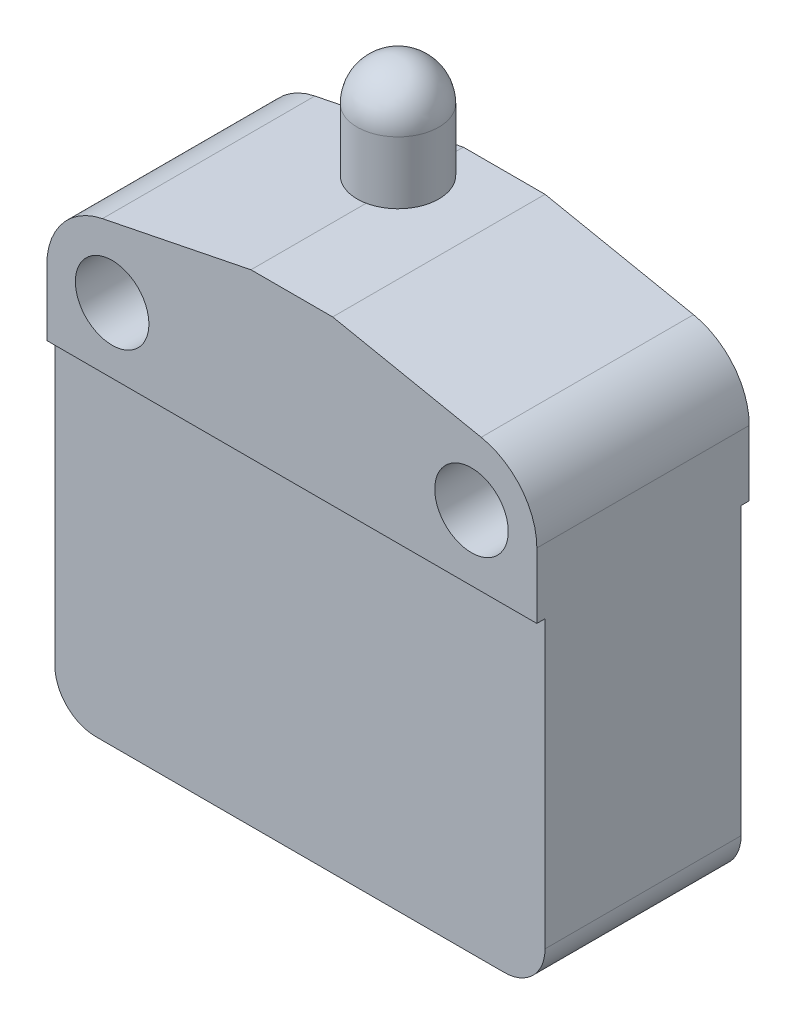
from build123d import *

# Parameters (mm, degrees)
SKETCH1_R              = 2.25
BOSS_EXTRUDE1_DEPTH    = 6.5
SKETCH2_R              = 2.5
BOSS_EXTRUDE2_DEPTH    = 9.3
FILLET1_R              = 2.49
CUT_EXTRUDE1_START     = -20
CUT_EXTRUDE1_OUTLINE_W = 30
CUT_EXTRUDE1_OUTLINE_H = 0.5
CUT_EXTRUDE1_DEPTH     = 20
CUT_EXTRUDE4_START     = -3
SKETCH6_R              = 2.5
CUT_EXTRUDE4_DEPTH     = 3


# Read off the part's stored shape, not the designer's step: Cut-Extrude1
with BuildPart() as part:
    # Sketch1 → Boss-Extrude1 (new, symmetric)
    with BuildSketch(Plane.XY):
        with BuildLine():
            Line((-2.5, 15), (-11.59047228, 13.166066052))
            ThreePointArc((-11.59047228, 13.166066052), (-14.038959348, 11.691699538), (-15, 9))
            Line((-15, 9), (-15, -12.5))
            ThreePointArc((-15, -12.5), (-14.267766953, -14.267766953), (-12.5, -15))
            Line((-12.5, -15), (12.5, -15))
            ThreePointArc((12.5, -15), (14.267766953, -14.267766953), (15, -12.5))
            Line((15, -12.5), (15, 9))
            ThreePointArc((15, 9), (14.038959348, 11.691699538), (11.59047228, 13.166066052))
            Line((11.59047228, 13.166066052), (2.5, 15))
            Line((2.5, 15), (-2.5, 15))
        make_face()
        with Locations(Location((-11, 9, 0), (0, 0, 180))):
            Circle(SKETCH1_R, mode=Mode.SUBTRACT)
        with Locations(Location((11, 9, 0), (0, 0, 180))):
            Circle(SKETCH1_R, mode=Mode.SUBTRACT)
    extrude(amount=BOSS_EXTRUDE1_DEPTH, both=True)

    # Sketch2 → Boss-Extrude2 (add)
    with BuildSketch(Plane(origin=(0, 15, 0), x_dir=(1, 0, 0), z_dir=(0, 1, 0))):
        with Locations(Location((0, 0, 0), (0, 0, 180))):
            Circle(SKETCH2_R)
    extrude(amount=BOSS_EXTRUDE2_DEPTH)

    # Fillet1
    fillet1_edges = [part.edges().sort_by_distance(p)[0] for p in [
        (2.5, 24.3, 0),
    ]]
    fillet(fillet1_edges, radius=FILLET1_R)

    # Cut-Extrude1 outline → Cut-Extrude1 (cut)
    with BuildSketch(Plane.XZ.offset(15).offset(CUT_EXTRUDE1_START)):
        with Locations((0, -6.25)):
            Rectangle(CUT_EXTRUDE1_OUTLINE_W, CUT_EXTRUDE1_OUTLINE_H)
        with Locations((0, 6.25)):
            Rectangle(CUT_EXTRUDE1_OUTLINE_W, CUT_EXTRUDE1_OUTLINE_H)
    extrude(amount=CUT_EXTRUDE1_DEPTH, mode=Mode.SUBTRACT)

    # Sketch6 → Cut-Extrude4 (cut)
    with BuildSketch(Plane(origin=(0, 18, -31.4), x_dir=(0, 0, 1), z_dir=(0, 1, 0)).offset(CUT_EXTRUDE4_START)):
        with Locations(Location((31.4, 0, 0), (0, 0, 270))):
            Circle(SKETCH6_R)
    extrude(amount=CUT_EXTRUDE4_DEPTH, mode=Mode.SUBTRACT)


with BuildPart() as cut_extrude4_piece_1:
    # of the separate pieces the step leaves, piece 1, a body of its own (cut_extrude4_pieces)
    add(part.part.solids().sort_by_distance((2.5, 15, 6.5))[0])


with BuildPart() as cut_extrude4_piece_2:
    # of the separate pieces the step leaves, piece 2, a body of its own (cut_extrude4_pieces)
    add(part.part.solids().sort_by_distance((-2.5, 18, 0))[0])


solid = Compound([cut_extrude4_piece_1.part, cut_extrude4_piece_2.part])
